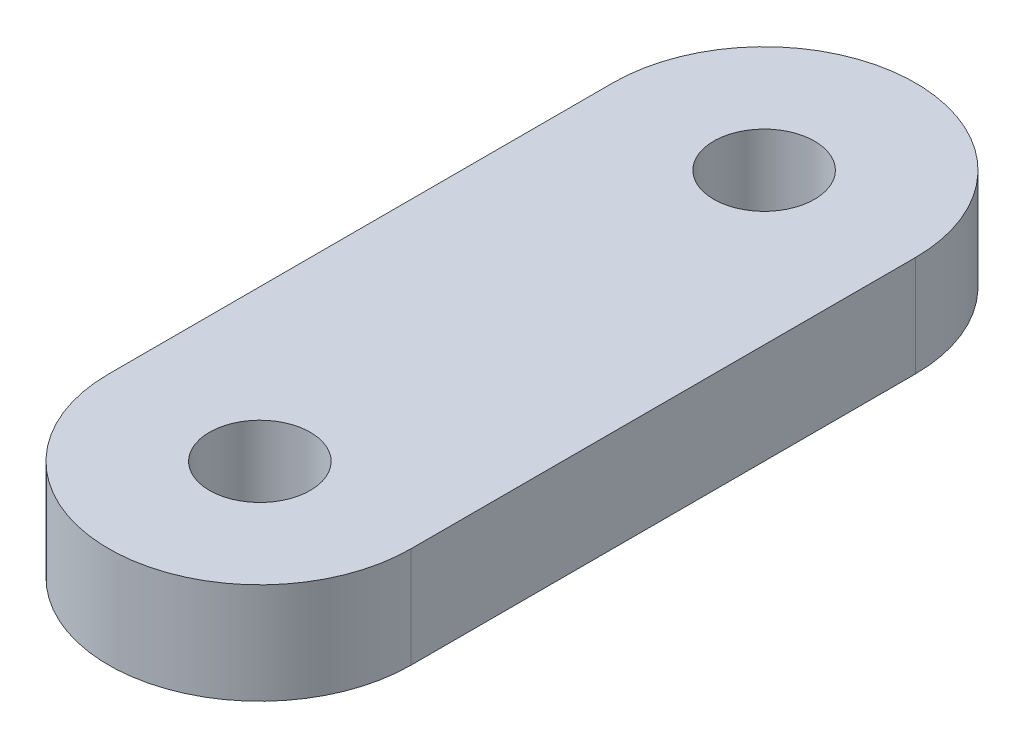
from build123d import *

# Parameters (mm, degrees)
SKETCH1_R           = 0.5
BOSS_EXTRUDE1_DEPTH = 1


with BuildPart() as part:
    # Sketch1 → Boss-Extrude1 (new body)
    with BuildSketch(Plane(origin=(0, 0, 0), x_dir=(1, 0, 0), z_dir=(0, 1, 0))):
        with BuildLine():
            Line((-1.5, 2.5), (-1.5, -2.5))
            ThreePointArc((-1.5, -2.5), (0, -4), (1.5, -2.5))
            Line((1.5, -2.5), (1.5, 2.5))
            ThreePointArc((1.5, 2.5), (0, 4), (-1.5, 2.5))
        make_face()
        with Locations((0, -2.5)):
            Circle(SKETCH1_R, mode=Mode.SUBTRACT)
        with Locations((0, 2.5)):
            Circle(SKETCH1_R, mode=Mode.SUBTRACT)
    extrude(amount=BOSS_EXTRUDE1_DEPTH)


solid = part.part
